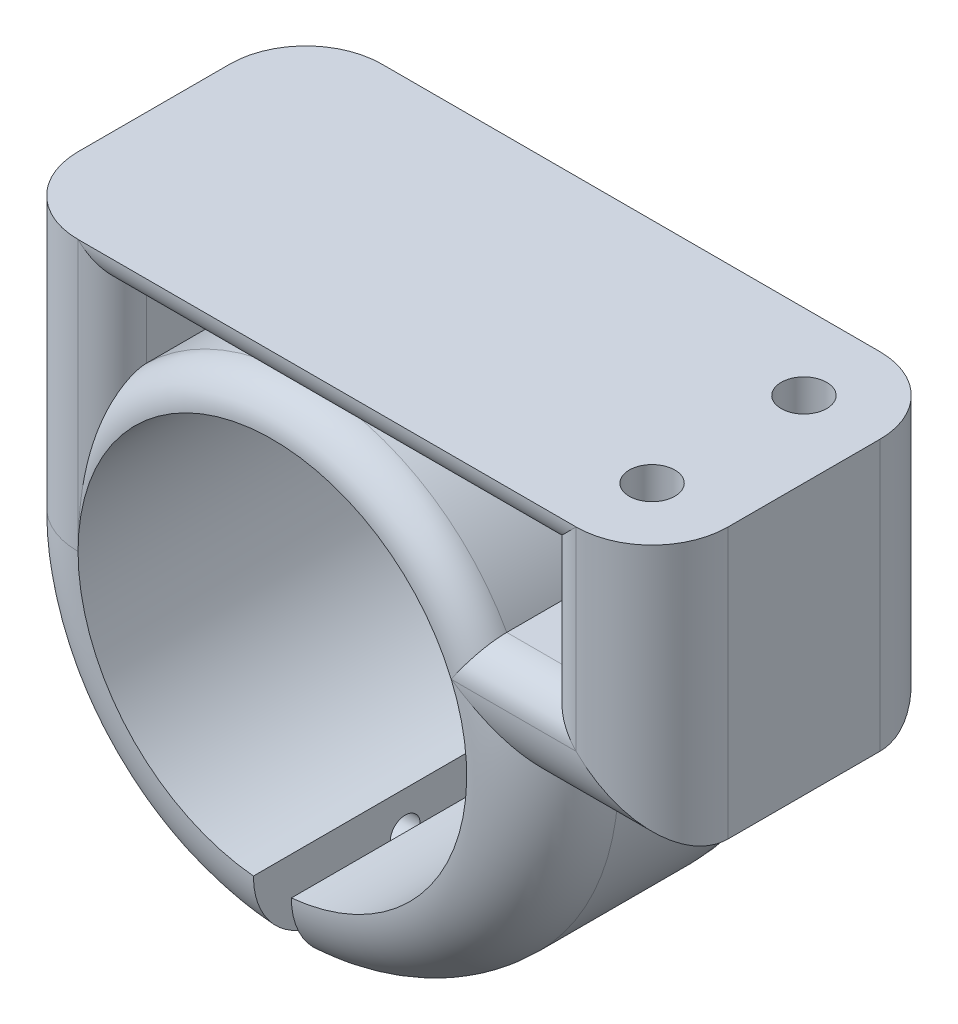
from build123d import *

# Parameters (mm, degrees)
SKETCH2_W           = 25.4
SKETCH2_H           = 50.8
SKETCH2_R           = 3.81
BOSS_EXTRUDE1_DEPTH = 25.4
BOSS_EXTRUDE2_DEPTH = 25.4
CUT_EXTRUDE1_DEPTH  = 170.18
CUT_EXTRUDE2_DEPTH  = 170.18
SKETCH5_3_W         = 19.05
SKETCH5_3_H         = 8.255
SKETCH5_3_R         = 2.5
CUT_EXTRUDE3_DEPTH  = 32.004
SKETCH6_R           = 3.81
CUT_EXTRUDE4_DEPTH  = 32.004
FILLET1_R           = 12.7
CUT_EXTRUDE6_DEPTH  = 50.8
FILLET2_R           = 5.715


# Some blends are built 0.0001 mm under size
with BuildPart() as part:
    # Sketch2 → Boss-Extrude1 (new body)
    with BuildSketch(Plane(origin=(0, 0, 0), x_dir=(1, 0, 0), z_dir=(0, 1, 0))):
        with Locations((-31.75, 0)):
            Rectangle(SKETCH2_W, SKETCH2_H)
        with Locations(Location((-31.75, -12.7, 0), (0, 0, 270))):
            Circle(SKETCH2_R, mode=Mode.SUBTRACT)
        with Locations(Location((-31.75, 12.7, 0), (0, 0, 270))):
            Circle(SKETCH2_R, mode=Mode.SUBTRACT)
    extrude(amount=-BOSS_EXTRUDE1_DEPTH)

    # Sketch3 → Boss-Extrude2 (add, symmetric)
    with BuildSketch(Plane.XY):
        with BuildLine():
            Line((-44.45, -25.4), (-44.45, 0))
            Line((-44.45, 0), (-127.75, 0))
            Line((-127.75, 0), (-127.75, -45.2))
            Line((-127.75, -45.2), (-115.05, -45.2))
            ThreePointArc((-115.05, -45.2), (-82.55, -12.7), (-50.05, -45.2))
            Line((-50.05, -45.2), (-37.35, -45.2))
            Line((-37.35, -45.2), (-19.05, -45.2))
            Line((-19.05, -45.2), (-19.05, -25.4))
            Line((-19.05, -25.4), (-44.45, -25.4))
        make_face()
        with BuildLine():
            Line((-115.05, -45.2), (-127.75, -45.2))
            ThreePointArc((-127.75, -45.2), (-82.55, -90.4), (-37.35, -45.2))
            Line((-37.35, -45.2), (-50.05, -45.2))
            ThreePointArc((-50.05, -45.2), (-82.55, -77.7), (-115.05, -45.2))
        make_face()
    extrude(amount=BOSS_EXTRUDE2_DEPTH, both=True)

    # Sketch4 → Cut-Extrude1 (cut)
    with BuildSketch(Plane.XY.offset(25.4)):
        with BuildLine():
            Line((-85.725, -90.288350768), (-85.725, -104.566683373))
            Line((-85.725, -104.566683373), (-79.375, -104.566683373))
            Line((-79.375, -104.566683373), (-79.375, -90.288350768))
            ThreePointArc((-79.375, -90.288350768), (-82.55, -90.4), (-85.725, -90.288350768))
        make_face()
        with BuildLine():
            ThreePointArc((-50.05, -45.2), (-104.379595736, -21.122650686), (-85.725, -77.544541657))
            Line((-85.725, -77.544541657), (-85.725, -50.833316627))
            Line((-85.725, -50.833316627), (-79.375, -50.833316627))
            Line((-79.375, -50.833316627), (-79.375, -77.544541657))
            ThreePointArc((-79.375, -77.544541657), (-58.472650686, -67.029595736), (-50.05, -45.2))
        make_face()
        with BuildLine():
            Line((-85.725, -50.833316627), (-85.725, -77.544541657))
            ThreePointArc((-85.725, -77.544541657), (-82.55, -77.7), (-79.375, -77.544541657))
            Line((-79.375, -77.544541657), (-79.375, -50.833316627))
            Line((-79.375, -50.833316627), (-85.725, -50.833316627))
        make_face()
        with BuildLine():
            Line((-85.725, -77.544541657), (-85.725, -90.288350768))
            ThreePointArc((-85.725, -90.288350768), (-82.55, -90.4), (-79.375, -90.288350768))
            Line((-79.375, -90.288350768), (-79.375, -77.544541657))
            ThreePointArc((-79.375, -77.544541657), (-82.55, -77.7), (-85.725, -77.544541657))
        make_face()
    extrude(amount=-CUT_EXTRUDE1_DEPTH, mode=Mode.SUBTRACT)

    # Sketch5 → Cut-Extrude2 (cut)
    with BuildSketch(Plane.ZY.offset(127.75)):
        with BuildLine():
            ThreePointArc((2.5, -83.916446213), (1.767766953, -82.14867926), (0, -81.416446213))
            Line((0, -81.416446213), (0, -86.416446213))
            ThreePointArc((0, -86.416446213), (1.767766953, -85.684213166), (2.5, -83.916446213))
        make_face()
        with BuildLine():
            Line((0, -86.416446213), (0, -81.416446213))
            ThreePointArc((0, -81.416446213), (-2.5, -83.916446213), (0, -86.416446213))
        make_face()
    extrude(amount=-CUT_EXTRUDE2_DEPTH, mode=Mode.SUBTRACT)

    # Sketch5<3> → Cut-Extrude3 (cut)
    with BuildSketch(Plane.ZY.offset(127.75)):
        with Locations((0, -83.916446213)):
            Rectangle(SKETCH5_3_W, SKETCH5_3_H)
        with Locations(Location((0, -83.916446213, 0), (0, 0, 270))):
            Circle(SKETCH5_3_R, mode=Mode.SUBTRACT)
    cut_extrude3 = extrude(amount=-CUT_EXTRUDE3_DEPTH, mode=Mode.SUBTRACT)

    # Mirror1: Cut-Extrude3 across plane
    add(cut_extrude3.mirror(Plane.ZY.offset(82.55)), mode=Mode.SUBTRACT)

    # Sketch6 → Cut-Extrude4 (cut)
    with BuildSketch(Plane(origin=(0, -25.4, 0), x_dir=(1, 0, 0), z_dir=(0, 1, 0))):
        with Locations(Location((-31.75, -12.7, 0), (0, 0, 270))):
            Circle(SKETCH6_R)
        with Locations(Location((-31.75, 12.7, 0), (0, 0, 270))):
            Circle(SKETCH6_R)
    extrude(amount=-CUT_EXTRUDE4_DEPTH, mode=Mode.SUBTRACT)

    # Fillet1
    # the kernel refuses this fillet: 12.7 mm, written as the material it takes off along each edge
    with BuildSketch(Plane(origin=(-82.55, -45.2, 25.4), x_dir=(-1, 0, 0), z_dir=(0, 1, 0))) as fillet1_piece_1:
        with BuildLine():
            CenterArc((45.2 - FILLET1_R, -FILLET1_R), FILLET1_R, 360, 90)
            Line((45.2, -FILLET1_R), (45.2, 0))
            Line((45.2, 0), (45.2 - FILLET1_R, 0))
        make_face()
    revolve(axis=Axis((-82.55, -45.2, 25.4), (0, 0, 1)), revolution_arc=126.233269218, mode=Mode.SUBTRACT)
    with BuildSketch(Plane(origin=(-82.55, -45.2, -25.4), x_dir=(-1, 0, 0), z_dir=(0, 1, 0))) as fillet1_piece_2:
        with BuildLine():
            CenterArc((45.2 - FILLET1_R, FILLET1_R), FILLET1_R, 270, 90)
            Line((45.2, FILLET1_R), (45.2, 0))
            Line((45.2, 0), (45.2 - FILLET1_R, 0))
        make_face()
    revolve(axis=Axis((-82.55, -45.2, -25.4), (0, 0, 1)), revolution_arc=126.233269218, mode=Mode.SUBTRACT)
    with BuildSketch(Plane(origin=(-19.05, -76.95, 25.4), x_dir=(-1, 0, 0), z_dir=(0, 1, 0))) as fillet1_piece_3:
        with BuildLine():
            CenterArc((FILLET1_R, -FILLET1_R), FILLET1_R, 90, 90)
            Line((0, -FILLET1_R), (0, 0))
            Line((0, 0), (FILLET1_R, 0))
        make_face()
    extrude(amount=108.7, mode=Mode.SUBTRACT)
    with BuildSketch(Plane(origin=(12.7, -45.2, -25.4), x_dir=(0, 0, 1), z_dir=(-1, 0, 0))) as fillet1_piece_4_section:
        with BuildLine():
            CenterArc((FILLET1_R, FILLET1_R), FILLET1_R, 180, 90)
            Line((0, FILLET1_R), (0, 0))
            Line((0, 0), (FILLET1_R, 0))
        make_face()
    fillet1_piece_4 = extrude(amount=81.8, mode=Mode.PRIVATE)
    fillet1_piece_4 = fillet1_piece_4 - Plane(origin=(-82.55, -45.2, -25.4), x_dir=(-1, 0, 0), z_dir=(0, 0, 1)) * Cylinder(45.2, 215, mode=Mode.PRIVATE)
    add(fillet1_piece_4, mode=Mode.SUBTRACT)
    with BuildSketch(Plane(origin=(-69.1, -45.2, 25.4), x_dir=(0, 1, 0), z_dir=(1, 0, 0))) as fillet1_piece_5_section:
        with BuildLine():
            CenterArc((FILLET1_R, -FILLET1_R), FILLET1_R, 90, 90)
            Line((0, -FILLET1_R), (0, 0))
            Line((0, 0), (FILLET1_R, 0))
        make_face()
    fillet1_piece_5 = extrude(amount=81.8, mode=Mode.PRIVATE)
    fillet1_piece_5 = fillet1_piece_5 - Plane(origin=(-82.55, -45.2, 25.4), x_dir=(-1, 0, 0), z_dir=(0, 0, 1)) * Cylinder(45.2, 215, mode=Mode.PRIVATE)
    add(fillet1_piece_5, mode=Mode.SUBTRACT)
    with BuildSketch(Plane(origin=(-82.55, -45.2, 25.4), x_dir=(-0.5910741355046212, -0.8066172365734969, 0), z_dir=(-0.8066172365734969, 0.5910741355046212, 0))) as fillet1_piece_6:
        with BuildLine():
            CenterArc((45.2 - FILLET1_R, -FILLET1_R), FILLET1_R, 360, 90)
            Line((45.2, -FILLET1_R), (45.2, 0))
            Line((45.2, 0), (45.2 - FILLET1_R, 0))
        make_face()
    revolve(axis=Axis((-82.55, -45.2, 25.4), (0, 0, 1)), revolution_arc=126.233269218, mode=Mode.SUBTRACT)
    with BuildSketch(Plane(origin=(-82.55, -45.2, -25.4), x_dir=(-0.5910741355045994, -0.8066172365735128, 0), z_dir=(-0.8066172365735128, 0.5910741355045994, 0))) as fillet1_piece_7:
        with BuildLine():
            CenterArc((45.2 - FILLET1_R, FILLET1_R), FILLET1_R, 270, 90)
            Line((45.2, FILLET1_R), (45.2, 0))
            Line((45.2, 0), (45.2 - FILLET1_R, 0))
        make_face()
    revolve(axis=Axis((-82.55, -45.2, -25.4), (0, 0, 1)), revolution_arc=126.233269218, mode=Mode.SUBTRACT)
    with BuildSketch(Plane(origin=(-127.75, 31.75, -25.4), x_dir=(1, 0, 0), z_dir=(0, -1, 0))) as fillet1_piece_8:
        with BuildLine():
            CenterArc((FILLET1_R, FILLET1_R), FILLET1_R, 180, 90)
            Line((0, FILLET1_R), (0, 0))
            Line((0, 0), (FILLET1_R, 0))
        make_face()
    extrude(amount=76.95, mode=Mode.SUBTRACT)
    with BuildSketch(Plane(origin=(-127.75, 31.75, 25.4), x_dir=(1, 0, 0), z_dir=(0, -1, 0))) as fillet1_piece_9:
        with BuildLine():
            CenterArc((FILLET1_R, -FILLET1_R), FILLET1_R, 90, 90)
            Line((0, -FILLET1_R), (0, 0))
            Line((0, 0), (FILLET1_R, 0))
        make_face()
    extrude(amount=76.95, mode=Mode.SUBTRACT)
    with BuildSketch(Plane(origin=(-19.05, -76.95, -25.4), x_dir=(-1, 0, 0), z_dir=(0, 1, 0))) as fillet1_piece_10:
        with BuildLine():
            CenterArc((FILLET1_R, FILLET1_R), FILLET1_R, 180, 90)
            Line((0, FILLET1_R), (0, 0))
            Line((0, 0), (FILLET1_R, 0))
        make_face()
    extrude(amount=108.7, mode=Mode.SUBTRACT)
    with BuildSketch(Plane(origin=(-19.05, -45.2, -25.4), x_dir=(0, 0, 1), z_dir=(-1, 0, 0))) as fillet1_piece_11a_section:
        with BuildLine():
            CenterArc((FILLET1_R, FILLET1_R), FILLET1_R, 180, 90)
            Line((0, FILLET1_R), (0, 0))
            Line((0, 0), (FILLET1_R, 0))
        make_face()
    fillet1_piece_11a = extrude(amount=50.05, mode=Mode.PRIVATE)
    fillet1_piece_11a = fillet1_piece_11a & Plane(origin=(-82.55, -45.2, -25.4), x_dir=(-1, 0, 0), z_dir=(0, 0, 1)) * Cylinder(45.2, 151, mode=Mode.PRIVATE)
    fillet1_piece_11a = fillet1_piece_11a - Plane(origin=(-82.55, -45.2, -25.4), x_dir=(-1, 0, 0), z_dir=(0, 0, 1)) * Cylinder(32.5, 151, mode=Mode.PRIVATE)
    with BuildSketch(Plane(origin=(-82.55, -45.2, -25.4), x_dir=(-0.5910741355045994, -0.8066172365735128, 0), z_dir=(-0.8066172365735128, 0.5910741355045994, 0))) as fillet1_piece_11b_section:
        with BuildLine():
            CenterArc((45.2 - FILLET1_R, FILLET1_R), FILLET1_R, 270, 90)
            Line((45.2, FILLET1_R), (45.2, 0))
            Line((45.2, 0), (45.2 - FILLET1_R, 0))
        make_face()
    fillet1_piece_11b = revolve(axis=Axis((-82.55, -45.2, -25.4), (0, 0, 1)), revolution_arc=166.494503726, mode=Mode.PRIVATE)
    fillet1_piece_11b = split(fillet1_piece_11b, bisect_by=Plane(origin=(-82.55, -45.2, -25.4), z_dir=(0, 1, 0)), keep=Keep.TOP, mode=Mode.PRIVATE)
    fillet1_piece_11 = fillet1_piece_11a & fillet1_piece_11b
    add(fillet1_piece_11, mode=Mode.SUBTRACT)
    with BuildSketch(Plane(origin=(-82.55, -45.2, 25.4), x_dir=(-0.5910741355046212, -0.8066172365734969, 0), z_dir=(-0.8066172365734969, 0.5910741355046212, 0))) as fillet1_piece_12a_section:
        with BuildLine():
            CenterArc((45.2 - FILLET1_R, -FILLET1_R), FILLET1_R, 360, 90)
            Line((45.2, -FILLET1_R), (45.2, 0))
            Line((45.2, 0), (45.2 - FILLET1_R, 0))
        make_face()
    fillet1_piece_12a = revolve(axis=Axis((-82.55, -45.2, 25.4), (0, 0, 1)), revolution_arc=166.494503726, mode=Mode.PRIVATE)
    fillet1_piece_12a = split(fillet1_piece_12a, bisect_by=Plane(origin=(-82.55, -45.2, 25.4), z_dir=(0, 1, 0)), keep=Keep.TOP, mode=Mode.PRIVATE)
    with BuildSketch(Plane(origin=(-69.1, -45.2, 25.4), x_dir=(0, 1, 0), z_dir=(1, 0, 0))) as fillet1_piece_12b_section:
        with BuildLine():
            CenterArc((FILLET1_R, -FILLET1_R), FILLET1_R, 90, 90)
            Line((0, -FILLET1_R), (0, 0))
            Line((0, 0), (FILLET1_R, 0))
        make_face()
    fillet1_piece_12b = extrude(amount=50.05, mode=Mode.PRIVATE)
    fillet1_piece_12b = fillet1_piece_12b & Plane(origin=(-82.55, -45.2, 25.4), x_dir=(-1, 0, 0), z_dir=(0, 0, 1)) * Cylinder(45.2, 151, mode=Mode.PRIVATE)
    fillet1_piece_12b = fillet1_piece_12b - Plane(origin=(-82.55, -45.2, 25.4), x_dir=(-1, 0, 0), z_dir=(0, 0, 1)) * Cylinder(32.5, 151, mode=Mode.PRIVATE)
    fillet1_piece_12 = fillet1_piece_12a & fillet1_piece_12b
    add(fillet1_piece_12, mode=Mode.SUBTRACT)

    # Sketch7 → Cut-Extrude6 (cut)
    with BuildSketch(Plane.XY.offset(25.4)):
        with BuildLine():
            Line((-49.064570333, -26.785), (-37.465, -26.785))
            Line((-37.465, -26.785), (-37.465, -5.715))
            Line((-37.465, -5.715), (-109.335, -5.715))
            Line((-109.335, -5.715), (-109.335, -17.942890836))
            ThreePointArc((-109.335, -17.942890836), (-77.002959073, -7.389729412), (-49.064570333, -26.785))
        make_face()
    extrude(amount=-CUT_EXTRUDE6_DEPTH, mode=Mode.SUBTRACT)

    # Fillet2
    fillet2_edges = [part.edges().sort_by_distance(p)[0] for p in [
        (-77.002959073, -7.389729412, -25.4),
        (-73.4, -5.715, -25.4),
        (-43.264785166, -26.785, 25.4),
        (-37.465, -16.25, 25.4),
        (-109.335, -11.828945418, 25.4),
        (-43.264785166, -26.785, -25.4),
        (-37.465, -16.25, -25.4),
        (-73.4, -5.715, 25.4),
        (-109.335, -11.828945418, -25.4),
        (-77.002959073, -7.389729412, 25.4),
    ]]
    fillet(fillet2_edges, radius=FILLET2_R - 0.0001)  # a hair under: the kernel refuses the full size


solid = part.part
